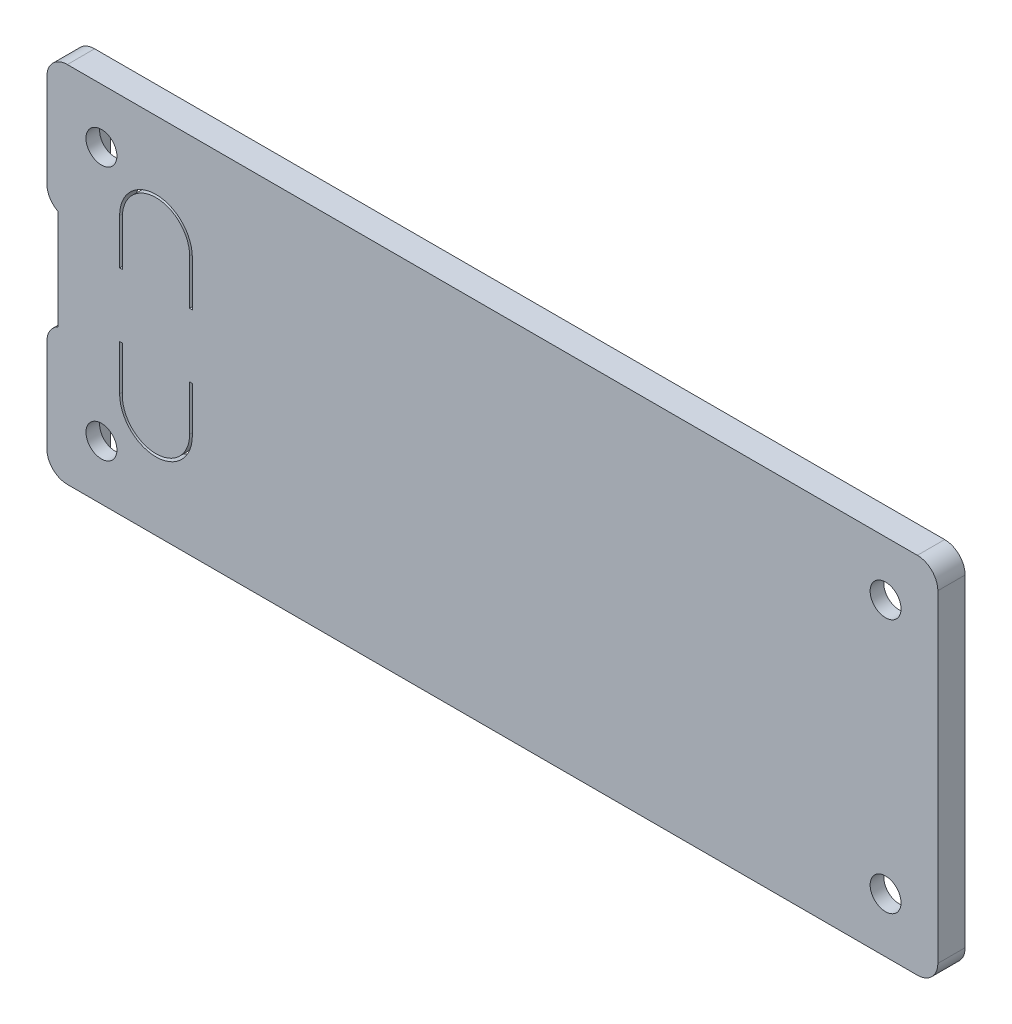
from build123d import *

# Parameters (mm, degrees)
SKETCH1_W           = 98
SKETCH1_H           = 40
BODY_DEPTH          = 3
SKETCH2_W           = 2.25
SKETCH2_H           = 10.5
CUT_EXTRUDE1_DEPTH  = 106.891453857
FILLET2_R           = 2.25
FILLET1_R           = 2.25
BOSS_EXTRUDE4_DEPTH = 3.7
SKETCH7_W           = 91.75
SKETCH7_H           = 35.5
OLED_RECESS_DEPTH   = 1.5
SKETCH9_R           = 1.7
CUT_EXTRUDE5_DEPTH  = 106.913596861


with BuildPart() as part:
    # Sketch1 → body (new body)
    with BuildSketch(Plane.XY):
        with Locations((49, 20)):
            Rectangle(SKETCH1_W, SKETCH1_H)
    extrude(amount=BODY_DEPTH)

    # Sketch2 → Cut-Extrude1 (cut, through all)
    with BuildSketch(Plane.XY.offset(3)):
        with Locations((1.125, 20)):
            Rectangle(SKETCH2_W, SKETCH2_H)
    extrude(amount=-CUT_EXTRUDE1_DEPTH, mode=Mode.SUBTRACT)

    # Fillet2
    fillet2_edges = [part.edges().sort_by_distance(p)[0] for p in [
        (0, 14.75, 1.5),
        (0, 25.25, 1.5),
    ]]
    fillet(fillet2_edges, radius=FILLET2_R - 0.0001)  # a hair under: the kernel refuses the full size

    # Fillet1
    fillet1_edges = [part.edges().sort_by_distance(p)[0] for p in [
        (0, 40, 1.5),
        (98, 40, 1.5),
        (98, 0, 1.5),
        (0, 0, 1.5),
    ]]
    fillet(fillet1_edges, radius=FILLET1_R)

    # Sketch6 → Boss-Extrude4 (add)
    with BuildSketch(Plane.XY.offset(3)):
        with BuildLine():
            Line((1.25, 25.484435563), (1.25, 14.515564437))
            ThreePointArc((1.25, 14.515564437), (1.736443763, 14.69060722), (2.25, 14.75))
            Line((2.25, 14.75), (2.25, 25.25))
            ThreePointArc((2.25, 25.25), (1.736443763, 25.30939278), (1.25, 25.484435563))
        make_face()
    extrude(amount=-BOSS_EXTRUDE4_DEPTH)

    # Sketch7 → oled-recess (cut)
    with BuildSketch(Plane(origin=(0, 0, 0), x_dir=(-1, 0, 0), z_dir=(0, 0, -1))):
        with Locations((-49.875, 20)):
            Rectangle(SKETCH7_W, SKETCH7_H)
    extrude(amount=-OLED_RECESS_DEPTH, mode=Mode.SUBTRACT)

    # Sketch9 → Cut-Extrude5 (cut, through all)
    with BuildSketch(Plane.XY.offset(3)):
        with Locations((6, 34)):
            Circle(SKETCH9_R)
        with Locations((92.25, 34)):
            Circle(SKETCH9_R)
        with Locations((6, 6)):
            Circle(SKETCH9_R)
        with Locations((92.25, 6)):
            Circle(SKETCH9_R)
        with BuildLine():
            Line((8, 28.5), (8, 23.5))
            Line((8, 23.5), (8.3, 23.5))
            Line((8.3, 23.5), (8.3, 28.5))
            ThreePointArc((8.3, 28.5), (12, 32.2), (15.7, 28.5))
            Line((15.7, 28.5), (15.7, 23.5))
            Line((15.7, 23.5), (16, 23.5))
            Line((16, 23.5), (16, 28.5))
            ThreePointArc((16, 28.5), (12, 32.5), (8, 28.5))
        make_face()
        with BuildLine():
            Line((15.7, 16.5), (16, 16.5))
            Line((16, 16.5), (16, 11.5))
            ThreePointArc((16, 11.5), (12, 7.5), (8, 11.5))
            Line((8, 11.5), (8, 16.5))
            Line((8, 16.5), (8.3, 16.5))
            Line((8.3, 16.5), (8.3, 11.5))
            ThreePointArc((8.3, 11.5), (12, 7.8), (15.7, 11.5))
            Line((15.7, 11.5), (15.7, 16.5))
        make_face()
    extrude(amount=-CUT_EXTRUDE5_DEPTH, mode=Mode.SUBTRACT)


solid = part.part
